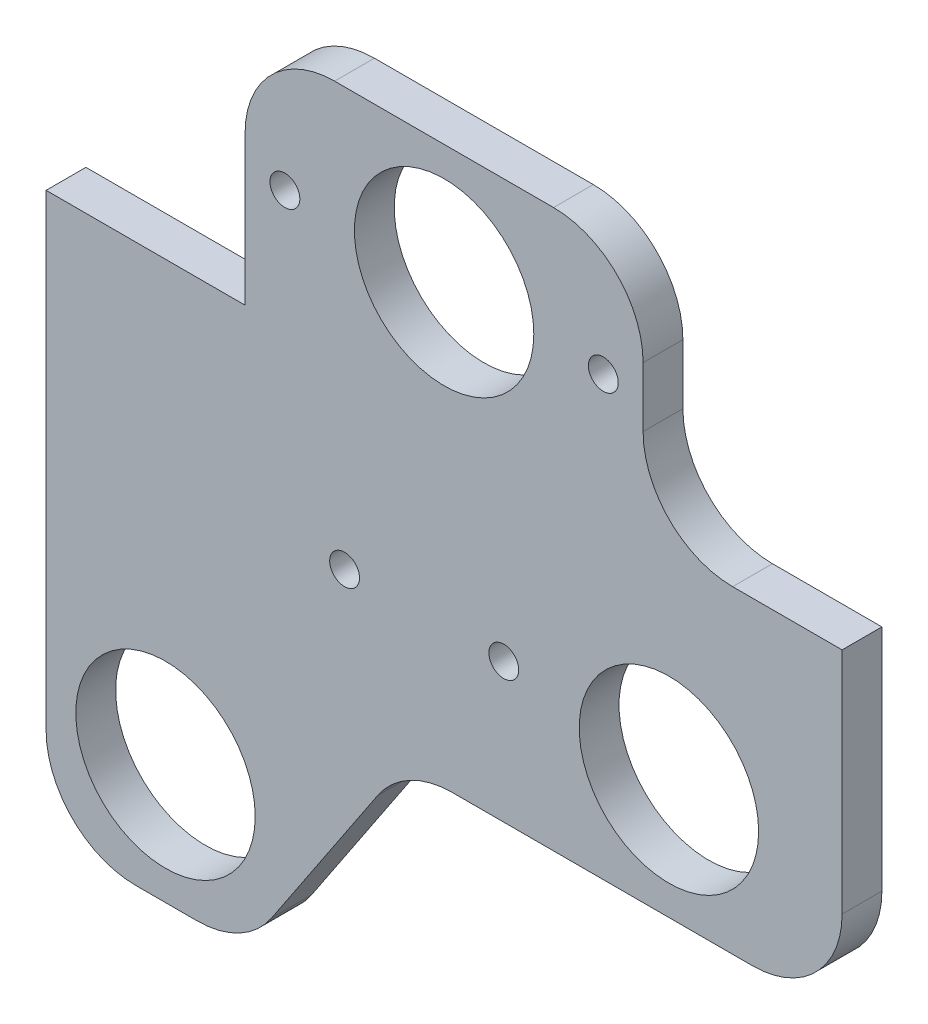
from build123d import *

# Parameters (mm, degrees)
SKETCH1_R           = 14.3129
BOSS_EXTRUDE1_DEPTH = 6.35
FILLET1_R           = 14.2875
SKETCH2_W           = 63.5
SKETCH2_H           = 38.1
BOSS_EXTRUDE2_DEPTH = 6.35
FILLET2_R           = 14.2875
SKETCH3_R           = 14.3129
CUT_EXTRUDE1_DEPTH  = 105.341147205
SKETCH4_R           = 2.38125
SKETCH4_R_2         = 14.2875
CUT_EXTRUDE2_DEPTH  = 105.341147205
SKETCH5_R           = 2.38125
CUT_EXTRUDE3_DEPTH  = 105.341147205


with BuildPart() as part:
    # Sketch1 → Boss-Extrude1 (new body)
    with BuildSketch(Plane.XY):
        Polygon((-6.35, -6.35), (63.5, -6.35), (63.5, 44.45), (-63.5, 44.45), (-63.5, -44.45), (-31.75, -44.45), align=None)
        with Locations((-44.45, -25.4)):
            Circle(SKETCH1_R, mode=Mode.SUBTRACT)
        with Locations((35.871852568, 12.7)):
            Circle(SKETCH1_R, mode=Mode.SUBTRACT)
    extrude(amount=BOSS_EXTRUDE1_DEPTH)

    # Fillet1
    fillet1_edges = [part.edges().sort_by_distance(p)[0] for p in [
        (63.5, -6.35, 3.175),
        (-6.35, -6.35, 3.175),
        (-31.75, -44.45, 3.175),
        (-63.5, -44.45, 3.175),
    ]]
    fillet(fillet1_edges, radius=FILLET1_R)

    # Sketch2 → Boss-Extrude2 (add)
    with BuildSketch(Plane.XY.offset(6.35)):
        with Locations((0, 63.5)):
            Rectangle(SKETCH2_W, SKETCH2_H)
    extrude(amount=-BOSS_EXTRUDE2_DEPTH)

    # Fillet2
    fillet2_edges = [part.edges().sort_by_distance(p)[0] for p in [
        (-31.75, 82.55, 3.175),
        (31.75, 82.55, 3.175),
        (31.75, 44.45, 3.175),
    ]]
    fillet(fillet2_edges, radius=FILLET2_R)

    # Sketch3 → Cut-Extrude1 (cut, through all)
    with BuildSketch(Plane.XY.offset(6.35)):
        with Locations((0, 63.5)):
            Circle(SKETCH3_R)
    extrude(amount=-CUT_EXTRUDE1_DEPTH, mode=Mode.SUBTRACT)

    # Sketch4 → Cut-Extrude2 (cut, through all)
    with BuildSketch(Plane.XY.offset(6.35)):
        with Locations((-25.4, 63.5)):
            Circle(SKETCH4_R)
        with Locations((25.4, 63.5)):
            Circle(SKETCH4_R)
        with Locations((0, 63.5)):
            Circle(SKETCH4_R_2)
    extrude(amount=-CUT_EXTRUDE2_DEPTH, mode=Mode.SUBTRACT)

    # Sketch5 → Cut-Extrude3 (cut, through all)
    with BuildSketch(Plane.XY.offset(6.35)):
        with Locations((-15.875, 15.875)):
            Circle(SKETCH5_R)
        with Locations((9.525, 15.875)):
            Circle(SKETCH5_R)
    extrude(amount=-CUT_EXTRUDE3_DEPTH, mode=Mode.SUBTRACT)


solid = part.part
